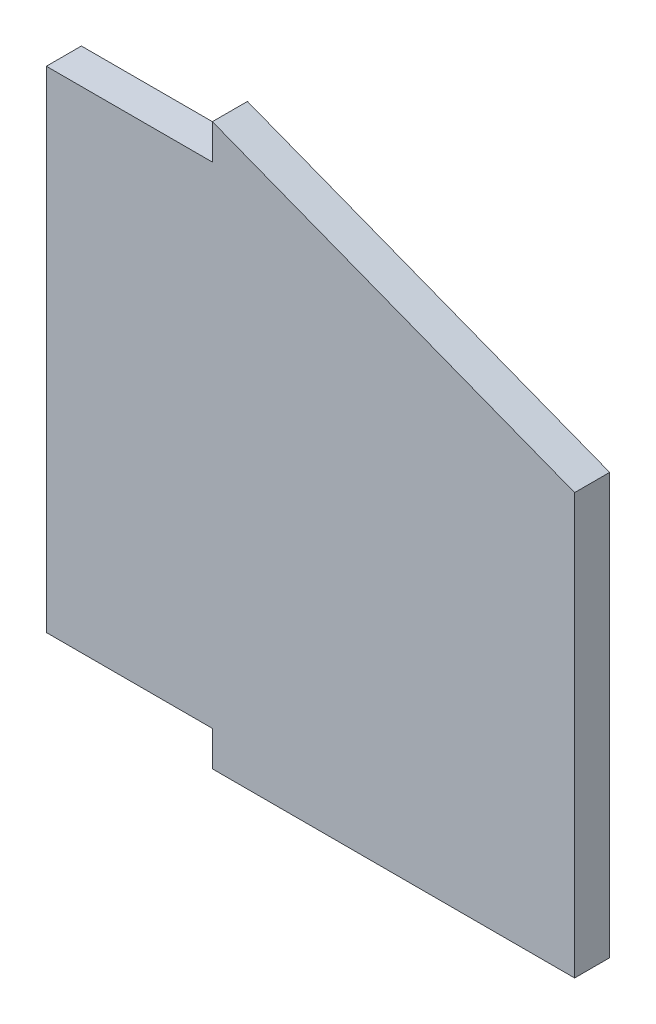
from build123d import *

# Parameters (mm, degrees)
BOSS_EXTRUDE1_DEPTH = 5


with BuildPart() as part:
    # Sketch1 → Boss-Extrude1 (new body)
    with BuildSketch(Plane.XY):
        Polygon((0, 0), (0, 70), (23.7, 70), (23.7, 75), (75.4, 55), (75.4, -5), (23.7, -5), (23.7, 0), align=None)
    extrude(amount=BOSS_EXTRUDE1_DEPTH)


solid = part.part
